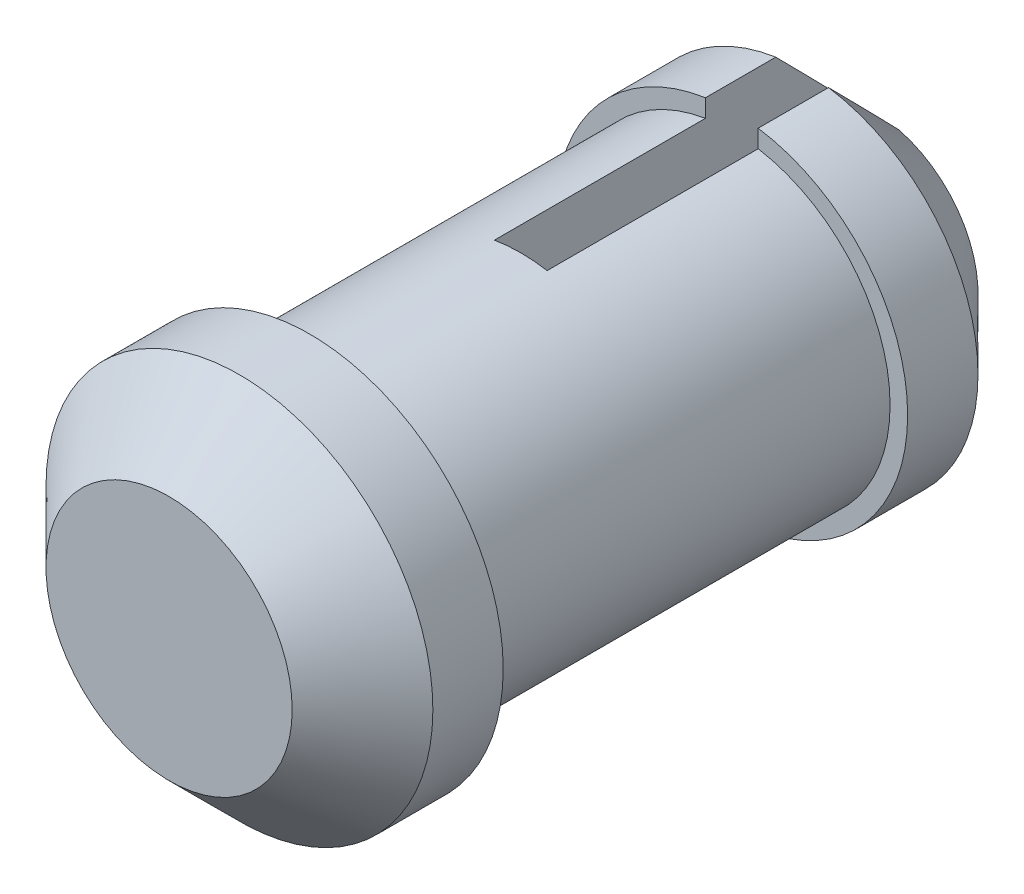
from build123d import *

# Parameters (mm, degrees)
CROQUIS1_R              = 4.5
SALIENTE_EXTRUIR1_DEPTH = 12
CROQUIS2_R              = 5
SALIENTE_EXTRUIR2_DEPTH = 4
CROQUIS3_R              = 5.5
SALIENTE_EXTRUIR3_DEPTH = 4
CROQUIS4_W              = 1.5
CROQUIS4_H              = 10.575793184
CORTAR_EXTRUIR1_DEPTH   = 10
CHAFL_N1_SIZE           = 2


with BuildPart() as part:
    # Croquis1 → Saliente-Extruir1 (new body)
    with BuildSketch(Plane.XY):
        Circle(CROQUIS1_R)
    extrude(amount=SALIENTE_EXTRUIR1_DEPTH)

    # Croquis2 → Saliente-Extruir2 (add)
    with BuildSketch(Plane(origin=(0, 0, 0), x_dir=(-1, 0, 0), z_dir=(0, 0, -1))):
        Circle(CROQUIS2_R)
    extrude(amount=SALIENTE_EXTRUIR2_DEPTH)

    # Croquis3 → Saliente-Extruir3 (add)
    with BuildSketch(Plane.XY.offset(12)):
        Circle(CROQUIS3_R)
    extrude(amount=SALIENTE_EXTRUIR3_DEPTH)

    # Croquis4 → Cortar-Extruir1 (cut)
    with BuildSketch(Plane(origin=(0, 0, -4), x_dir=(-1, 0, 0), z_dir=(0, 0, -1))):
        with Locations((0, 0.015667842)):
            Rectangle(CROQUIS4_W, CROQUIS4_H)
    extrude(amount=-CORTAR_EXTRUIR1_DEPTH, mode=Mode.SUBTRACT)

    # Chaflán1
    chafl_n1_edges = [part.edges().sort_by_distance(p)[0] for p in [
        (-5.5, 0, 16),
        (-5, 0, -4),
        (5, 0, -4),
    ]]
    chamfer(chafl_n1_edges, length=CHAFL_N1_SIZE)


solid = part.part
